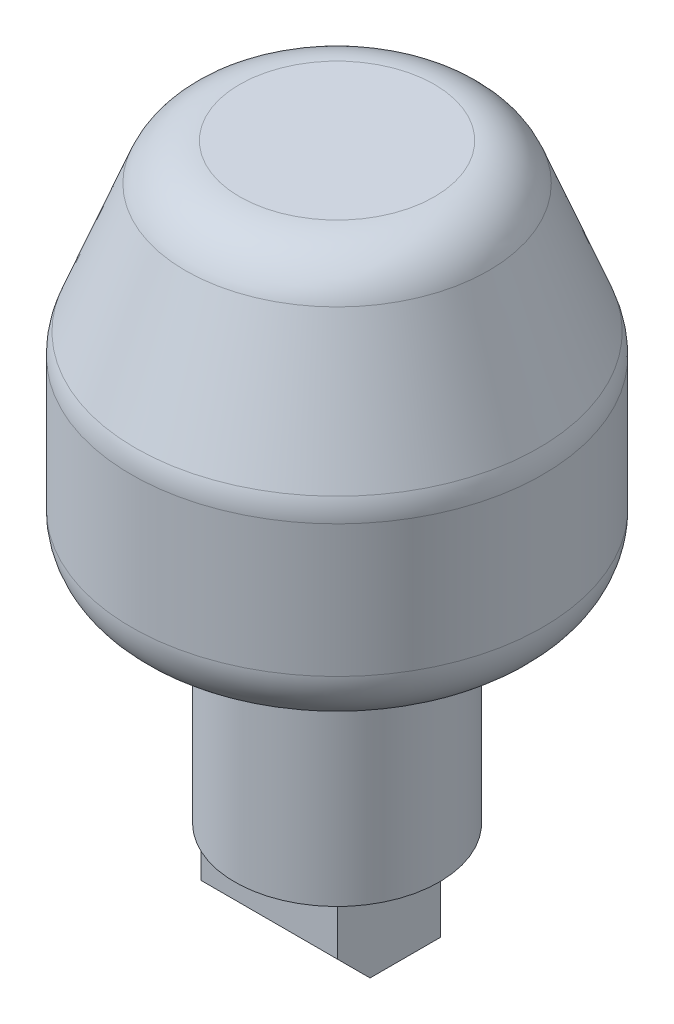
from build123d import *

# Parameters (mm, degrees)
SKETCH2_R           = 11.176
BOSS_EXTRUDE1_DEPTH = 23.4188
SKETCH3_W           = 14.9098
SKETCH3_H           = 11.2522
BOSS_EXTRUDE2_DEPTH = 9.017
SKETCH4_W           = 4.842933334
SKETCH4_H           = 7.423880536
CUT_EXTRUDE1_DEPTH  = 2.54
SKETCH5_W           = 4.779433333
SKETCH5_H           = 7.423880536
CUT_EXTRUDE2_DEPTH  = 2.54
SKETCH6_W           = 4.761113869
SKETCH6_H           = 7.423880536
CUT_EXTRUDE3_DEPTH  = 2.54
RIB1_START          = -1.778
RIB1_OUTLINE_W      = 3.294408818
RIB1_OUTLINE_H      = 2.1844
RIB1_DEPTH          = 3.556
CHAMFER1_SIZE       = 3.556
FILLET1_R           = 6.35


# Read off the part's stored shape, not the designer's step: Rib1
with BuildPart() as part:
    # Sketch1 → Revolve1 (revolve)
    with BuildSketch(Plane(origin=(0, 0, 0), x_dir=(-1, 0, 0), z_dir=(0, 0, -1)), mode=Mode.PRIVATE) as revolve1_sk:
        Polygon((-22.479, 0), (0, 0), (0, 41.1988), (-14.986000072, 41.1988), (-22.479, 21.996399801), align=None)
    revolve(revolve1_sk.sketch.rotate(Axis((0, 0, 0), (0, 1, 0)), 270), axis=Axis((0, 0, 0), (0, 1, 0)))

    # Sketch2 → Boss-Extrude1 (add)
    with BuildSketch(Plane.XZ):
        with Locations(Location((0, 0, 0), (0, 0, 270))):
            Circle(SKETCH2_R)
    extrude(amount=BOSS_EXTRUDE1_DEPTH)

    # Sketch3 → Boss-Extrude2 (add)
    with BuildSketch(Plane.XZ.offset(23.4188)):
        with Locations((0, 1.778)):
            Rectangle(SKETCH3_W, SKETCH3_H)
    extrude(amount=BOSS_EXTRUDE2_DEPTH)

    # Sketch4 → Cut-Extrude1 (cut)
    with BuildSketch(Plane.XZ.offset(32.4358)):
        Rectangle(SKETCH4_W, SKETCH4_H)
    extrude(amount=-CUT_EXTRUDE1_DEPTH, mode=Mode.SUBTRACT)

    # Sketch5 → Cut-Extrude2 (cut)
    with BuildSketch(Plane.XZ.offset(32.4358)):
        with Locations((-4.938183334, 0)):
            Rectangle(SKETCH5_W, SKETCH5_H)
    extrude(amount=-CUT_EXTRUDE2_DEPTH, mode=Mode.SUBTRACT)

    # Sketch6 → Cut-Extrude3 (cut)
    with BuildSketch(Plane.XZ.offset(32.4358)):
        with Locations((4.929023601, 0)):
            Rectangle(SKETCH6_W, SKETCH6_H)
    extrude(amount=-CUT_EXTRUDE3_DEPTH, mode=Mode.SUBTRACT)

    # Rib1 outline → Rib1 (add)
    with BuildSketch(Plane(origin=(0, 0, 0), x_dir=(0, 0, -1), z_dir=(1, 0, 0)).offset(RIB1_START)):
        with Locations((-12.647204409, -1.0922)):
            Rectangle(RIB1_OUTLINE_W, RIB1_OUTLINE_H)
    extrude(amount=RIB1_DEPTH)

    # Chamfer1
    chamfer1_edges = [part.edges().sort_by_distance(p)[0] for p in [
        (0, -32.4358, 7.4041),
    ]]
    chamfer(chamfer1_edges, length=CHAMFER1_SIZE)

    # Fillet1
    fillet1_edges = [part.edges().sort_by_distance(p)[0] for p in [
        (0, 21.996399801, -22.479),
        (0, 41.1988, -14.986000072),
        (0, 0, -22.479),
    ]]
    fillet(fillet1_edges, radius=FILLET1_R)


solid = part.part
